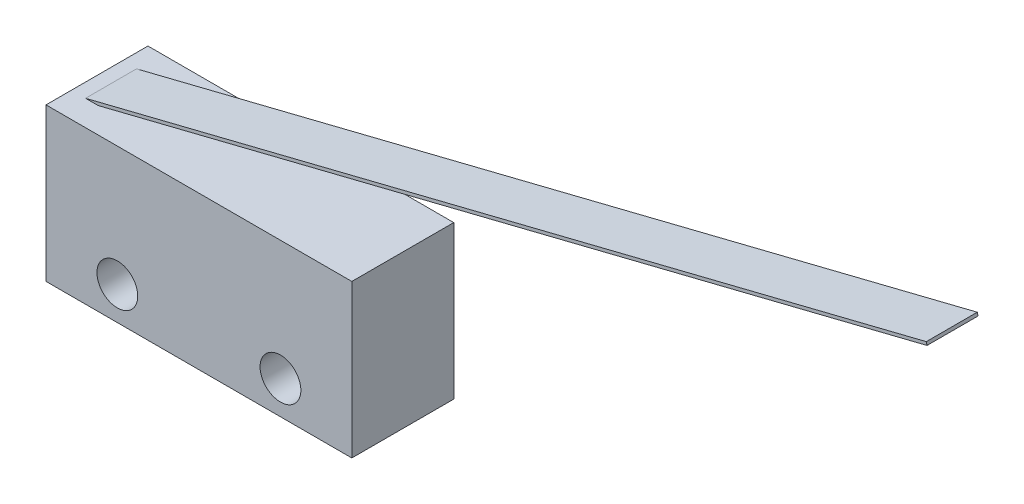
from build123d import *

# Parameters (mm, degrees)
SKETCH1_W           = 19.05
SKETCH1_H           = 9.525
BOSS_EXTRUDE1_DEPTH = 6.35
BOSS_EXTRUDE2_START = 1.5875
BOSS_EXTRUDE2_DEPTH = 3.175
SKETCH3_R           = 1.27
CUT_EXTRUDE1_DEPTH  = 59.227939899


with BuildPart() as part:
    # Sketch1 → Boss-Extrude1 (new body)
    with BuildSketch(Plane.XY):
        with Locations((9.525, 4.7625)):
            Rectangle(SKETCH1_W, SKETCH1_H)
    extrude(amount=BOSS_EXTRUDE1_DEPTH)

    # Sketch2 → Boss-Extrude2 (add)
    with BuildSketch(Plane.XY.offset(BOSS_EXTRUDE2_START)):
        Polygon((0.875640633, 9.525), (53.247352459, 22.582734315), (53.29343858, 22.397892979), (1.66308486, 9.525), align=None)
    extrude(amount=BOSS_EXTRUDE2_DEPTH)

    # Sketch3 → Cut-Extrude1 (cut, through all)
    with BuildSketch(Plane.XY.offset(6.35)):
        with Locations((4.445, 2.06375)):
            Circle(SKETCH3_R)
        with Locations((14.605, 2.06375)):
            Circle(SKETCH3_R)
    extrude(amount=-CUT_EXTRUDE1_DEPTH, mode=Mode.SUBTRACT)


solid = part.part
